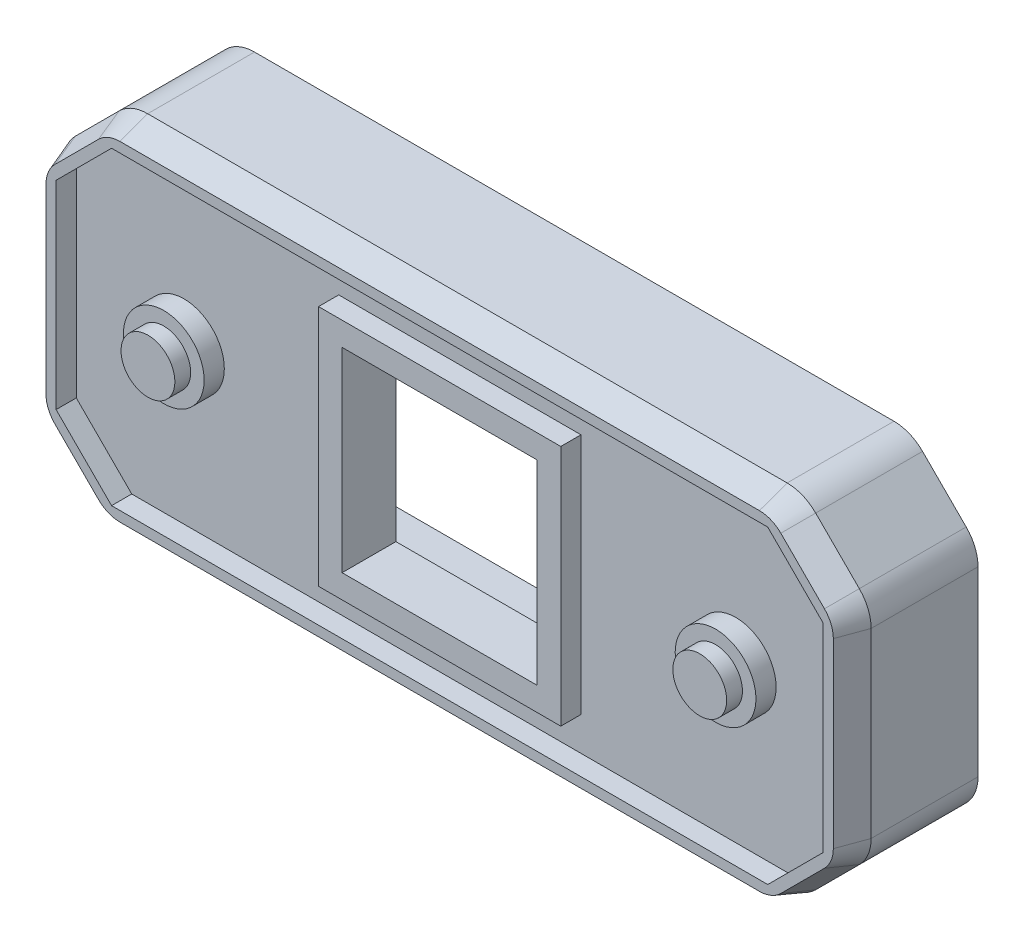
from build123d import *

# Parameters (mm, degrees)
SKETCH1_W           = 60
SKETCH1_H           = 26
BOSS_EXTRUDE2_DEPTH = 10
SKETCH1_5_W         = 56
SKETCH1_5_H         = 22
CUT_EXTRUDE1_DEPTH  = 6
CHAMFER1_SIZE       = 5
SKETCH2_W           = 14.5
SKETCH2_H           = 14.5
CUT_EXTRUDE2_DEPTH  = 34.241540277
CHAMFER2_SIZE       = 5
SKETCH3_W           = 18
SKETCH3_H           = 18
CUT_EXTRUDE3_DEPTH  = 1.5
SKETCH4_R           = 3
BOSS_EXTRUDE4_DEPTH = 1.5
SKETCH5_R           = 2
BOSS_EXTRUDE5_DEPTH = 1.175
SKETCH6_R           = 1.5
SKETCH6_R_2         = 0.875
BOSS_EXTRUDE6_DEPTH = 4.5
CHAMFER3_SIZE       = 2
FILLET1_R           = 3
CHAMFER4_SIZE       = 0.75
CHAMFER4_SIZE2      = 2.060608065


with BuildPart() as part:
    # Sketch1 → Boss-Extrude2 (new body)
    with BuildSketch(Plane.XY):
        Rectangle(SKETCH1_W, SKETCH1_H)
    extrude(amount=BOSS_EXTRUDE2_DEPTH)

    # Sketch1<5> → Cut-Extrude1 (cut)
    with BuildSketch(Plane.XY):
        Rectangle(SKETCH1_5_W, SKETCH1_5_H)
    extrude(amount=CUT_EXTRUDE1_DEPTH, mode=Mode.SUBTRACT)

    # Chamfer1
    chamfer1_edges = [part.edges().sort_by_distance(p)[0] for p in [
        (28, 11, 3),
        (-28, 11, 3),
        (-28, -11, 3),
        (28, -11, 3),
    ]]
    chamfer(chamfer1_edges, length=CHAMFER1_SIZE)

    # Sketch2 → Cut-Extrude2 (cut, through all)
    with BuildSketch(Plane(origin=(0, 0, 6), x_dir=(-1, 0, 0), z_dir=(0, 0, -1))):
        Rectangle(SKETCH2_W, SKETCH2_H)
    extrude(amount=-CUT_EXTRUDE2_DEPTH, mode=Mode.SUBTRACT)

    # Chamfer2
    chamfer2_edges = [part.edges().sort_by_distance(p)[0] for p in [
        (30, 13, 5),
        (30, -13, 5),
        (-30, -13, 5),
        (-30, 13, 5),
    ]]
    chamfer(chamfer2_edges, length=CHAMFER2_SIZE)

    # Sketch3 → Cut-Extrude3 (cut)
    with BuildSketch(Plane.XY.offset(10)):
        Polygon((-28.5, 7.378679656), (-28.5, -7.378679656), (-24.378679656, -11.5), (24.378679656, -11.5), (28.5, -7.378679656), (28.5, 7.378679656), (24.378679656, 11.5), (-24.378679656, 11.5), align=None)
        Rectangle(SKETCH3_W, SKETCH3_H, mode=Mode.SUBTRACT)
    extrude(amount=-CUT_EXTRUDE3_DEPTH, mode=Mode.SUBTRACT)

    # Sketch4 → Boss-Extrude4 (add)
    with BuildSketch(Plane.XY.offset(8.5)):
        with Locations((-20.5, 0)):
            Circle(SKETCH4_R)
    boss_extrude4 = extrude(amount=BOSS_EXTRUDE4_DEPTH)

    # Sketch5 → Boss-Extrude5 (add)
    with BuildSketch(Plane.XY.offset(10)):
        with Locations((-20.5, 0)):
            Circle(SKETCH5_R)
    boss_extrude5 = extrude(amount=BOSS_EXTRUDE5_DEPTH)

    # Mirror1: Boss-Extrude4, Boss-Extrude5 across plane
    add(boss_extrude4.mirror(Plane(origin=(0, 0, 0), x_dir=(0, 0, 1), z_dir=(1, 0, 0))))
    add(boss_extrude5.mirror(Plane(origin=(0, 0, 0), x_dir=(0, 0, 1), z_dir=(1, 0, 0))))

    # Sketch6 → Boss-Extrude6 (add)
    # profile 1 of 2: a face of its own
    with BuildSketch(Plane(origin=(0, 0, 6), x_dir=(-1, 0, 0), z_dir=(0, 0, -1))):
        with Locations(Location((-18.891430022, -8.28, 0), (0, 0, 180))):
            Circle(SKETCH6_R)
        with Locations((-18.891430022, -8.28)):
            Circle(SKETCH6_R_2, mode=Mode.SUBTRACT)
    # profile 2 of 2: a face of its own
    with BuildSketch(Plane(origin=(0, 0, 6), x_dir=(-1, 0, 0), z_dir=(0, 0, -1))):
        with Locations(Location((20.972750365, 8.32, 0), (0, 0, 180))):
            Circle(SKETCH6_R)
        with Locations((20.972750365, 8.32)):
            Circle(SKETCH6_R_2, mode=Mode.SUBTRACT)
    extrude(amount=BOSS_EXTRUDE6_DEPTH)

    # Chamfer3
    # the kernel refuses this chamfer: 2 mm, written as the material it adds along each edge
    with BuildSketch(Plane(origin=(18.891430022, -8.28, 6), x_dir=(1, 0, 0), z_dir=(0, 1, 0))) as chamfer3_piece_1:
        Polygon((1.5 + CHAMFER3_SIZE, 0), (1.5, CHAMFER3_SIZE), (1.5, 0), align=None)
    revolve(axis=Axis((18.891430022, -8.28, 6), (0, 0, -1)))
    with BuildSketch(Plane(origin=(-20.972750365, 8.32, 6), x_dir=(1, 0, 0), z_dir=(0, 1, 0))) as chamfer3_piece_2:
        Polygon((1.5 + CHAMFER3_SIZE, 0), (1.5, CHAMFER3_SIZE), (1.5, 0), align=None)
    revolve(axis=Axis((-20.972750365, 8.32, 6), (0, 0, -1)))

    # Fillet1
    fillet1_edges = [part.edges().sort_by_distance(p)[0] for p in [
        (25, -13, 5),
        (-25, -13, 5),
        (-30, 8, 5),
        (-30, -8, 5),
        (30, 8, 5),
        (30, -8, 5),
        (-25, 13, 5),
        (25, 13, 5),
    ]]
    fillet(fillet1_edges, radius=FILLET1_R)

    # Chamfer4
    chamfer4_edges = [part.edges().sort_by_distance(p)[0] for p in [
        (30, 0, 10),
        (-30, 0, 10),
        (-27.5, -10.5, 10),
        (0, -13, 10),
        (27.5, -10.5, 10),
        (27.5, 10.5, 10),
        (0, 13, 10),
        (-27.5, 10.5, 10),
        (29.771638598, -7.90540961, 10),
        (24.90540961, -12.771638598, 10),
        (-24.90540961, -12.771638598, 10),
        (-29.771638598, -7.90540961, 10),
        (-29.771638598, 7.90540961, 10),
        (-24.90540961, 12.771638598, 10),
        (24.90540961, 12.771638598, 10),
        (29.771638598, 7.90540961, 10),
    ]]
    chamfer4_side = [part.faces().sort_by_distance(p)[0] for p in [
        (-29.346088691, 0, 10),
    ]]
    chamfer(chamfer4_edges, length=CHAMFER4_SIZE, length2=CHAMFER4_SIZE2, reference=chamfer4_side[0])


solid = part.part
